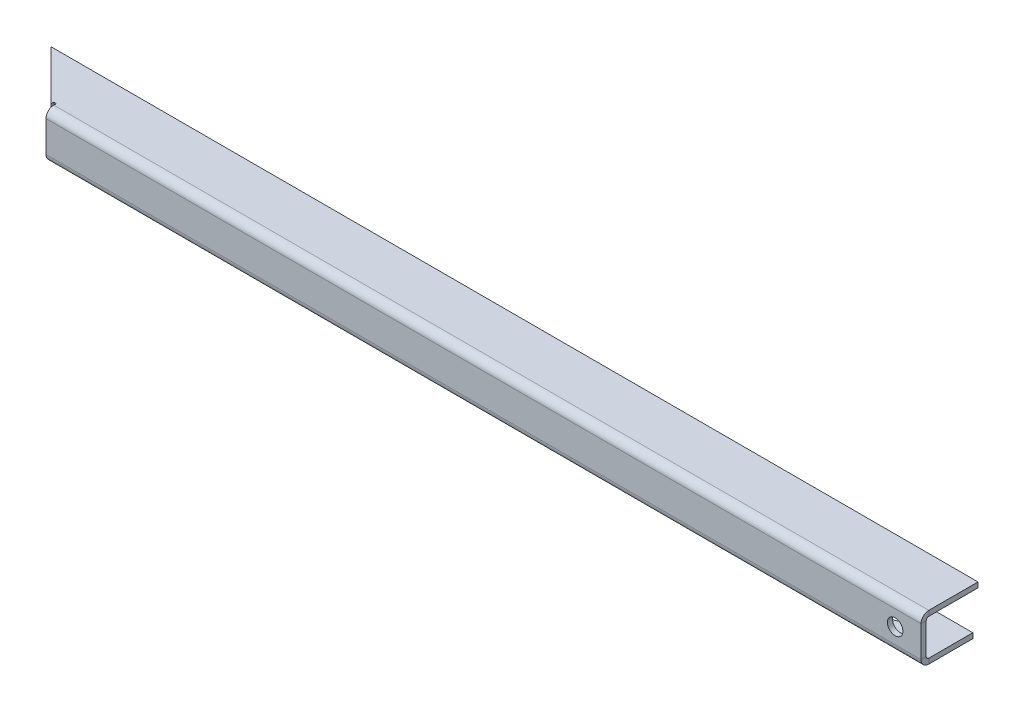
from build123d import *

# Parameters (mm, degrees)
BASE_FLANGE1_DEPTH            = 1
EDGE_FLANGE1_STRIP_W          = 5
EDGE_FLANGE1_STRIP_H          = 1
EDGE_FLANGE1_STRIP_CUT_DEPTH  = 169
EDGE_FLANGE1_RELIEF_W         = 5.5
EDGE_FLANGE1_RELIEF_H         = 0.5
EDGE_FLANGE1_RELIEF_CUT_DEPTH = 1
EDGE_FLANGE1_DEPTH            = 169
EDGE_FLANGE2_STRIP_W          = 5
EDGE_FLANGE2_STRIP_H          = 1
EDGE_FLANGE2_STRIP_CUT_DEPTH  = 169
EDGE_FLANGE2_DEPTH            = 169
SKETCH12_R                    = 1.5
CUT_EXTRUDE1_DEPTH            = 3
SKETCH13_R                    = 1.5
CUT_EXTRUDE2_DEPTH            = 3


# Sheet-metal steps are written as plain solids
with BuildPart() as part:
    # Sketch1 → Base-Flange1 (new body)
    with BuildSketch(Plane(origin=(0, 0, 0), x_dir=(1, 0, 0), z_dir=(0, 1, 0))):
        Polygon((-84.5, 0), (84.5, 0), (84.5, 10), (-94.5, 10), align=None)
    extrude(amount=-BASE_FLANGE1_DEPTH)

    # Edge-Flange1 strip (across the edge) → Edge-Flange1 strip cut (cut)
    with BuildSketch(Plane(origin=(84.5, -1, 0), x_dir=(0, 0, -1), z_dir=(-1, 0, 0))):
        with Locations((-2, -0.5)):
            Rectangle(EDGE_FLANGE1_STRIP_W, EDGE_FLANGE1_STRIP_H)
    extrude(amount=EDGE_FLANGE1_STRIP_CUT_DEPTH, mode=Mode.SUBTRACT)

    # Edge-Flange1 relief (on the sheet) → Edge-Flange1 relief cut (cut)
    with BuildSketch(Plane(origin=(84.5, -1, -0.5), x_dir=(0, 0, -1), z_dir=(0, -1, 0))):
        with Locations((-2.25, -169.25)):
            Rectangle(EDGE_FLANGE1_RELIEF_W, EDGE_FLANGE1_RELIEF_H)
    extrude(amount=-EDGE_FLANGE1_RELIEF_CUT_DEPTH, mode=Mode.SUBTRACT)

    # Edge-Flange1 section (across the edge) → Edge-Flange1 (add)
    with BuildSketch(Plane(origin=(84.5, -1, 0), x_dir=(0, 0, -1), z_dir=(-1, 0, 0))):
        with BuildLine():
            Line((-1, 0.5), (-1, 7))
            Line((-1, 7), (0, 7))
            Line((0, 7), (0, 0.5))
            ThreePointArc((0, 0.5), (0.146446609, 0.146446609), (0.5, 0))
            Line((0.5, 0), (0.5, -1))
            ThreePointArc((0.5, -1), (-0.560660172, -0.560660172), (-1, 0.5))
        make_face()
    extrude(amount=EDGE_FLANGE1_DEPTH)

    # Edge-Flange2 strip (across the edge) → Edge-Flange2 strip cut (cut)
    with BuildSketch(Plane(origin=(84.5, -8, 0), x_dir=(0, 1, 0), z_dir=(-1, 0, 0))):
        with Locations((-2, -0.5)):
            Rectangle(EDGE_FLANGE2_STRIP_W, EDGE_FLANGE2_STRIP_H)
    extrude(amount=EDGE_FLANGE2_STRIP_CUT_DEPTH, mode=Mode.SUBTRACT)

    # Edge-Flange2 section (across the edge) → Edge-Flange2 (add)
    with BuildSketch(Plane(origin=(84.5, -8, 0), x_dir=(0, 1, 0), z_dir=(-1, 0, 0))):
        with BuildLine():
            Line((-1, 0.5), (-1, 9))
            Line((-1, 9), (0, 9))
            Line((0, 9), (0, 0.5))
            ThreePointArc((0, 0.5), (0.146446609, 0.146446609), (0.5, 0))
            Line((0.5, 0), (0.5, -1))
            ThreePointArc((0.5, -1), (-0.560660172, -0.560660172), (-1, 0.5))
        make_face()
    extrude(amount=EDGE_FLANGE2_DEPTH)

    # Sketch12 → Cut-Extrude1 (cut)
    with BuildSketch(Plane.XZ.offset(9)):
        with Locations(Location((-74.5, -5, 0), (0, 0, 270))):
            Circle(SKETCH12_R)
        with Locations(Location((0, -5, 0), (0, 0, 270))):
            Circle(SKETCH12_R)
        with Locations(Location((74.5, -5, 0), (0, 0, 270))):
            Circle(SKETCH12_R)
    extrude(amount=-CUT_EXTRUDE1_DEPTH, mode=Mode.SUBTRACT)

    # Sketch13 → Cut-Extrude2 (cut)
    with BuildSketch(Plane(origin=(0, 0, 0), x_dir=(-1, 0, 0), z_dir=(0, 0, -1))):
        with Locations(Location((-79.5, -4.5, 0), (0, 0, 90))):
            Circle(SKETCH13_R)
    extrude(amount=-CUT_EXTRUDE2_DEPTH, mode=Mode.SUBTRACT)


solid = part.part
